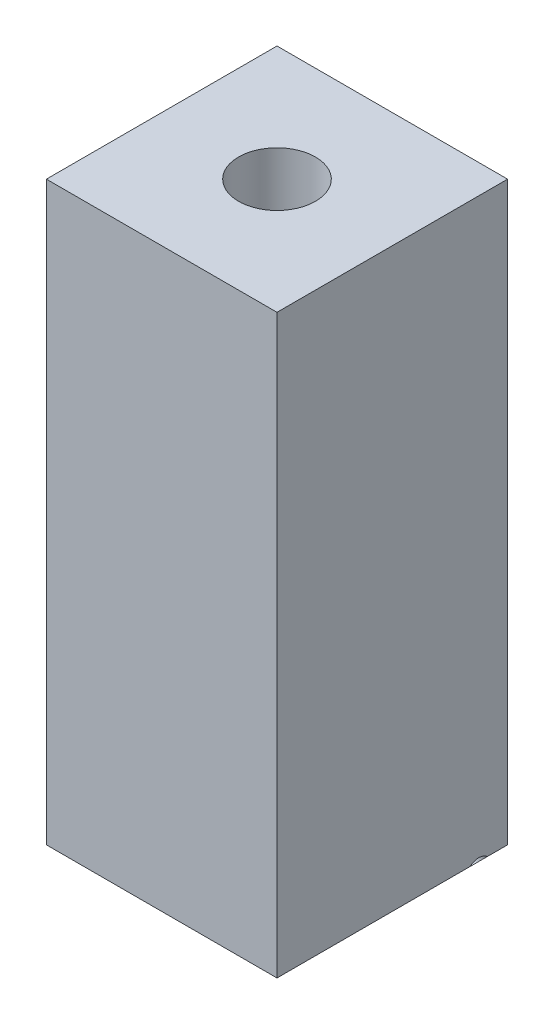
from build123d import *

# Parameters (mm, degrees)
SKETCH_1_W                = 160
SKETCH_1_H                = 60
EXTRUDE_1_DEPTH           = 60
HOLE_WIZARD_6_7_6_7_1_D   = 6.7
HOLE_WIZARD_1_D           = 20
HOLE_WIZARD_1_CBORE_D     = 47
HOLE_WIZARD_1_CBORE_DEPTH = 14
CHAMFER_1_SIZE            = 10


with BuildPart() as part:
    # Эскиз1 → Бобышка-Вытянуть1 (new body)
    with BuildSketch(Plane(origin=(-30, 0, 0), x_dir=(0, -1, 0), z_dir=(-1, 0, 0))):
        with Locations((-80, 96.453617418)):
            Rectangle(SKETCH_1_W, SKETCH_1_H)
    extrude(amount=-EXTRUDE_1_DEPTH)

    # Диаметр отверстия Ø6.7 (6.7)1 (through all)
    with Locations(Plane.ZY.offset(30)):
        with Locations((73.953617418, 7.5)):
            Hole(HOLE_WIZARD_6_7_6_7_1_D / 2)

    # Отверстие1 (through all)
    with Locations(Plane(origin=(0, 0, 0), x_dir=(-1, 0, 0), z_dir=(0, -1, 0))):
        with Locations((0, -96.453617418)):
            CounterBoreHole(HOLE_WIZARD_1_D / 2, HOLE_WIZARD_1_CBORE_D / 2, HOLE_WIZARD_1_CBORE_DEPTH)

    # Фаска1
    # the kernel refuses this chamfer: 10 mm, written as the material it takes off along each edge
    with BuildSketch(Plane(origin=(-30, 0, 40.736787538), x_dir=(0.9996219169112968, -0.027495876610586372, 0), z_dir=(0, 0, 1)), Plane(origin=(-55.71682988, 0, 126.453617418), x_dir=(0, -0.027495876610586372, -0.9996219169112968), z_dir=(1, 0, 0))) as chamfer_1_piece_1:
        Polygon((CHAMFER_1_SIZE * 0.999621916911, CHAMFER_1_SIZE * 0.0274958766106), (-CHAMFER_1_SIZE * 0.0274958766106, CHAMFER_1_SIZE * 0.999621916911), (0, 0), align=None)
    extrude(amount=111.433659759, mode=Mode.SUBTRACT)
    with BuildSketch(Plane(origin=(-55.71682988, 0, 66.453617418), x_dir=(0, -0.027495876610586372, 0.9996219169112968), z_dir=(1, 0, 0)), Plane(origin=(30, 0, 40.736787538), x_dir=(-0.9996219169112968, -0.027495876610586372, 0), z_dir=(0, 0, 1))) as chamfer_1_piece_2:
        Polygon((CHAMFER_1_SIZE * 0.999621916911, -CHAMFER_1_SIZE * 0.0274958766106), (-CHAMFER_1_SIZE * 0.0274958766106, -CHAMFER_1_SIZE * 0.999621916911), (0, 0), align=None)
    extrude(amount=111.433659759, mode=Mode.SUBTRACT)


solid = part.part
